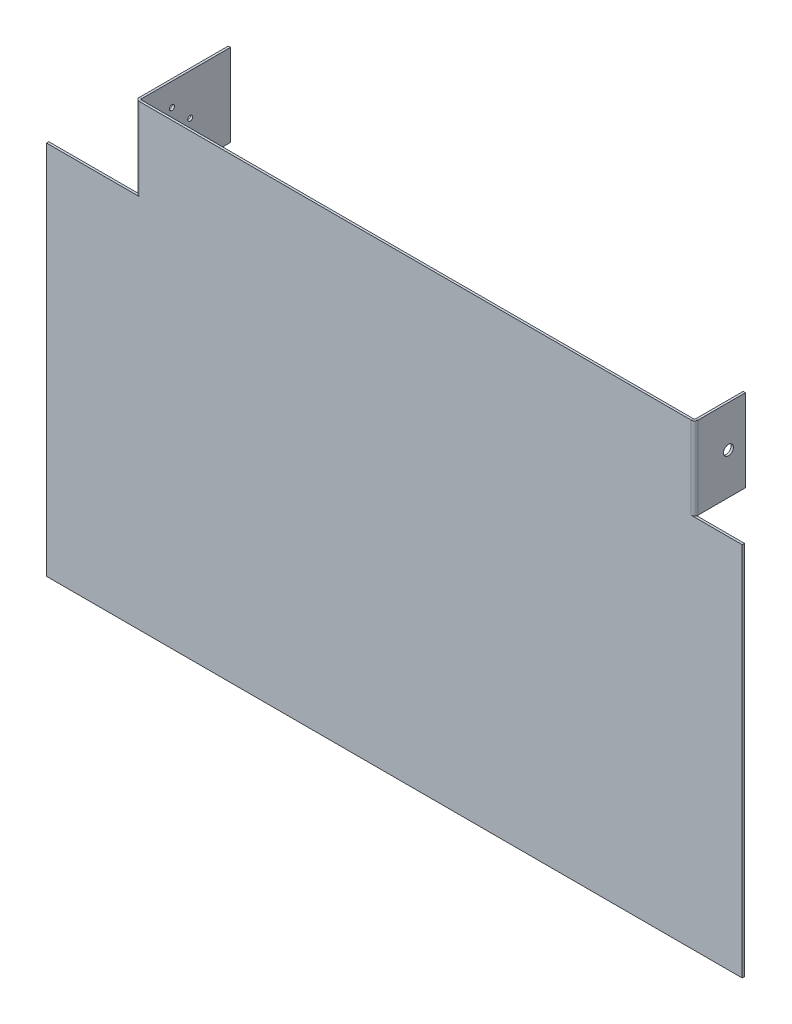
from build123d import *

# Parameters (mm, degrees)
SKETCH1_W                    = 304
SKETCH1_H                    = 200
BASE_FLANGE1_DEPTH           = 1
SKETCH2_W                    = 39
SKETCH2_H                    = 36
CUT_EXTRUDE1_DEPTH           = 10
EDGE_FLANGE1_STRIP_W         = 5
EDGE_FLANGE1_STRIP_H         = 1
EDGE_FLANGE1_STRIP_CUT_DEPTH = 36
EDGE_FLANGE1_DEPTH           = 36
SKETCH9_R                    = 1.1
SKETCH9_R_2                  = 3
CUT_EXTRUDE2_DEPTH           = 10
CUT_EXTRUDE4_REACH           = 368.129
SKETCH18_W                   = 20.8
SKETCH18_H                   = 36
EDGE_FLANGE2_STRIP_W         = 5
EDGE_FLANGE2_STRIP_H         = 1
EDGE_FLANGE2_STRIP_CUT_DEPTH = 36
EDGE_FLANGE2_DEPTH           = 36
M4_CLEARANCE_HOLE2_D         = 4.3


# Sheet-metal steps are written as plain solids
with BuildPart() as part:
    # Sketch1 → Base-Flange1 (new body)
    with BuildSketch(Plane.XY):
        with Locations((-152, 100)):
            Rectangle(SKETCH1_W, SKETCH1_H)
    extrude(amount=-BASE_FLANGE1_DEPTH)

    # Sketch2 → Cut-Extrude1 (cut)
    with BuildSketch(Plane.XY):
        with Locations((-284.5, 182)):
            Rectangle(SKETCH2_W, SKETCH2_H)
    extrude(amount=-CUT_EXTRUDE1_DEPTH, mode=Mode.SUBTRACT)

    # Edge-Flange1 strip (across the edge) → Edge-Flange1 strip cut (cut)
    with BuildSketch(Plane(origin=(-265, 164, -1), x_dir=(1, 0, 0), z_dir=(0, 1, 0))):
        with Locations((-1, -0.5)):
            Rectangle(EDGE_FLANGE1_STRIP_W, EDGE_FLANGE1_STRIP_H)
    extrude(amount=EDGE_FLANGE1_STRIP_CUT_DEPTH, mode=Mode.SUBTRACT)

    # Edge-Flange1 section (across the edge) → Edge-Flange1 (add)
    with BuildSketch(Plane(origin=(-265, 164, -1), x_dir=(1, 0, 0), z_dir=(0, 1, 0))):
        with BuildLine():
            Line((0, 0.5), (0, 39.429))
            Line((0, 39.429), (1, 39.429))
            Line((1, 39.429), (1, 0.5))
            ThreePointArc((1, 0.5), (1.146446609, 0.146446609), (1.5, 0))
            Line((1.5, 0), (1.5, -1))
            ThreePointArc((1.5, -1), (0.439339828, -0.560660172), (0, 0.5))
        make_face()
    extrude(amount=EDGE_FLANGE1_DEPTH)

    # Sketch9 → Cut-Extrude2 (cut)
    with BuildSketch(Plane(origin=(-264, 0, 0), x_dir=(0, 0, -1), z_dir=(1, 0, 0))):
        with Locations((22.8, 182)):
            Circle(SKETCH9_R)
        with Locations((14.8, 190)):
            Circle(SKETCH9_R)
        with Locations((14.8, 174)):
            Circle(SKETCH9_R)
        with Locations((6.8, 182)):
            Circle(SKETCH9_R)
        with Locations((14.8, 182)):
            Circle(SKETCH9_R_2)
    extrude(amount=-CUT_EXTRUDE2_DEPTH, mode=Mode.SUBTRACT)

    # Sketch18 → Cut-Extrude4 (cut, up to next)
    with BuildSketch(Plane.XY, mode=Mode.PRIVATE) as cut_extrude4_sk1:
        with Locations((-10.4, 182)):
            Rectangle(SKETCH18_W, SKETCH18_H)
    cut_extrude4_tool1 = extrude(cut_extrude4_sk1.sketch, amount=-CUT_EXTRUDE4_REACH, mode=Mode.PRIVATE) & part.part
    add(cut_extrude4_tool1.solids().sort_by_distance((-10.4, 182, 0))[0], mode=Mode.SUBTRACT)

    # Edge-Flange2 strip (across the edge) → Edge-Flange2 strip cut (cut)
    with BuildSketch(Plane(origin=(-20.8, 200, -1), x_dir=(-1, 0, 0), z_dir=(0, -1, 0))):
        with Locations((-1, -0.5)):
            Rectangle(EDGE_FLANGE2_STRIP_W, EDGE_FLANGE2_STRIP_H)
    extrude(amount=EDGE_FLANGE2_STRIP_CUT_DEPTH, mode=Mode.SUBTRACT)

    # Edge-Flange2 section (across the edge) → Edge-Flange2 (add)
    with BuildSketch(Plane(origin=(-20.8, 200, -1), x_dir=(-1, 0, 0), z_dir=(0, -1, 0))):
        with BuildLine():
            Line((0, 0.5), (0, 21.2292))
            Line((0, 21.2292), (1, 21.2292))
            Line((1, 21.2292), (1, 0.5))
            ThreePointArc((1, 0.5), (1.146446609, 0.146446609), (1.5, 0))
            Line((1.5, 0), (1.5, -1))
            ThreePointArc((1.5, -1), (0.439339828, -0.560660172), (0, 0.5))
        make_face()
    extrude(amount=EDGE_FLANGE2_DEPTH)

    # M4 Clearance Hole2 (through all)
    with Locations(Plane.ZY.offset(21.8)):
        with Locations((-14.8, 182)):
            Hole(M4_CLEARANCE_HOLE2_D / 2)


solid = part.part
